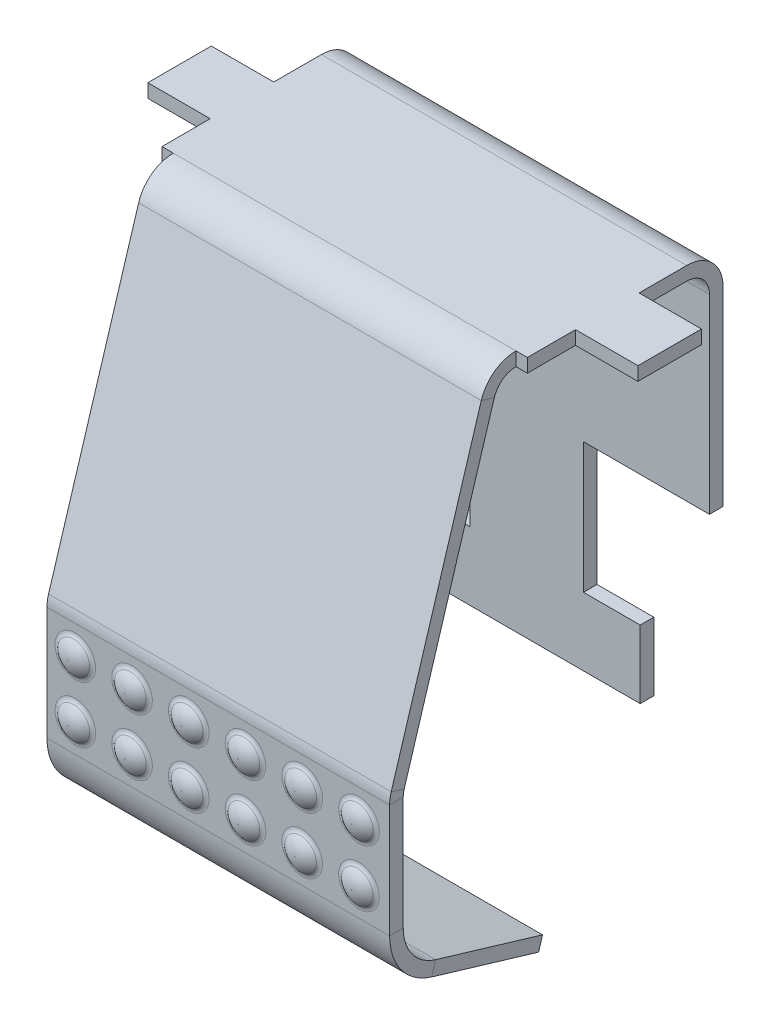
from build123d import *

# Parameters (mm, degrees)
BASE_FLANGE1_DEPTH     = 7.9248
SKETCH6_W              = 1.4224
SKETCH6_H              = 0.3048
BOSS_EXTRUDE1_DEPTH    = 1.016
SKETCH7_W              = 2.1844
SKETCH7_H              = 9.355592462
CUT_EXTRUDE1_DEPTH     = 18.125283198
BOSS_EXTRUDE2_DEPTH    = 0.3048
CUT_EXTRUDE3_REACH     = 14.95
BOSS_EXTRUDE5_START    = 0.127
SKETCH17_W             = 1.079336494
SKETCH17_H             = 0.3048
BOSS_EXTRUDE5_DEPTH    = 0.127
SKETCH18_W             = 1.4224
SKETCH18_H             = 0.3048
BOSS_EXTRUDE6_DEPTH    = 0.508
EDGE_FLANGE1_DEPTH     = 8.1788
EDGE_FLANGE2_DEPTH     = 8.1788
EDGE_FLANGE3_DEPTH     = 8.1788
SKETCH38_R             = 0.3937
BOSS_EXTRUDE7_DEPTH    = 0.166878
FILLET1_R              = 0.530606
FILLET2_R              = 0.1524
LPATTERN3_COUNT        = 6
LPATTERN3_PITCH        = 1.27
LPATTERN3_COUNT_DIR2   = 2
LPATTERN3_PITCH_DIR2   = 1.27
FILLET1_OF_LPATTERN3_R = 0.530606
FILLET2_OF_LPATTERN3_R = 0.1524
CUT_EXTRUDE4_START     = -0.254
CUT_EXTRUDE4_DEPTH     = 0.254


# Read off the part's stored shape, not the designer's step: SurfaceCut1
# Sheet-metal steps are written as plain solids
with BuildPart() as part:
    # Sketch1 → Base-Flange1 (new body)
    with BuildSketch(Plane(origin=(0, 0, 0), x_dir=(0, 0, -1), z_dir=(1, 0, 0))):
        with BuildLine():
            Line((0, 0), (0, 4.2672))
            ThreePointArc((0, 4.2672), (-0.238063608, 4.841936392), (-0.8128, 5.08))
            Line((-0.8128, 5.08), (-4.381336494, 5.08))
            ThreePointArc((-4.381336494, 5.08), (-4.911163821, 4.88358206), (-5.184919317, 4.38925936))
            Line((-5.184919317, 4.38925936), (-6.693208159, -5.5406223))
            ThreePointArc((-6.693208159, -5.5406223), (-6.678749154, -5.857431349), (-6.544153202, -6.144591522))
            Line((-6.544153202, -6.144591522), (-5.621689854, -7.397477204))
            Line((-5.621689854, -7.397477204), (-5.253554372, -7.897477204))
            Line((-5.253554372, -7.897477204), (-5.008106423, -7.716761006))
            Line((-5.008106423, -7.716761006), (-5.376241904, -7.216761006))
            Line((-5.376241904, -7.216761006), (-6.298705252, -5.963875324))
            ThreePointArc((-6.298705252, -5.963875324), (-6.382827723, -5.784400216), (-6.391864601, -5.586394561))
            Line((-6.391864601, -5.586394561), (-4.883575758, 4.3434871))
            ThreePointArc((-4.883575758, 4.3434871), (-4.712478573, 4.652438788), (-4.381336494, 4.7752))
            Line((-4.381336494, 4.7752), (-0.8128, 4.7752))
            ThreePointArc((-0.8128, 4.7752), (-0.453589755, 4.626410245), (-0.3048, 4.2672))
            Line((-0.3048, 4.2672), (-0.3048, 0))
            Line((-0.3048, 0), (0, 0))
        make_face()
    extrude(amount=BASE_FLANGE1_DEPTH)

    # Sketch6 → Boss-Extrude1 (add)
    with BuildSketch(Plane(origin=(7.9248, 0, 0), x_dir=(0, 0, -1), z_dir=(1, 0, 0))):
        with Locations((-2.5908, 4.9276)):
            Rectangle(SKETCH6_W, SKETCH6_H)
    boss_extrude1 = extrude(amount=BOSS_EXTRUDE1_DEPTH)

    # Mirror1: Boss-Extrude1 across plane
    add(boss_extrude1.mirror(Plane(origin=(3.9624, 0, 0), x_dir=(0, 0, 1), z_dir=(1, 0, 0))))

    # Sketch7 → Cut-Extrude1 (cut, through all)
    with BuildSketch(Plane(origin=(0, 5.08, 0), x_dir=(1, 0, 0), z_dir=(0, 1, 0))):
        with Locations((0.0762, -9.059132725)):
            Rectangle(SKETCH7_W, SKETCH7_H)
        with Locations((7.8486, -9.059132725)):
            Rectangle(SKETCH7_W, SKETCH7_H)
    extrude(amount=-CUT_EXTRUDE1_DEPTH, mode=Mode.SUBTRACT)

    # Sketch8 → Boss-Extrude2 (add)
    with BuildSketch(Plane(origin=(0, 0, 0), x_dir=(-1, 0, 0), z_dir=(0, 0, -1))):
        Polygon((-5.2324, 0), (-2.6924, 0), (-2.6924, -2.921), (-1.4224, -2.921), (-1.4224, -4.445), (-6.5024, -4.445), (-6.5024, -2.921), (-5.2324, -2.921), align=None)
    extrude(amount=-BOSS_EXTRUDE2_DEPTH)

    # Sketch12 → Cut-Extrude3 (cut, up to next)
    with BuildSketch(Plane(origin=(6.7564, 0, 0), x_dir=(0, 0, -1), z_dir=(1, 0, 0)), mode=Mode.PRIVATE) as cut_extrude3_sk1:
        with BuildLine():
            Line((-4.381336494, 4.7752), (-4.381336494, 5.08))
            ThreePointArc((-4.381336494, 5.08), (-4.911163821, 4.88358206), (-5.184919317, 4.38925936))
            Line((-5.184919317, 4.38925936), (-6.693208159, -5.5406223))
            ThreePointArc((-6.693208159, -5.5406223), (-6.678749154, -5.857431349), (-6.544153202, -6.144591522))
            Line((-6.544153202, -6.144591522), (-5.253554372, -7.897477204))
            Line((-5.253554372, -7.897477204), (-5.008106423, -7.716761006))
            Line((-5.008106423, -7.716761006), (-6.298705252, -5.963875324))
            ThreePointArc((-6.298705252, -5.963875324), (-6.382827723, -5.784400216), (-6.391864601, -5.586394561))
            Line((-6.391864601, -5.586394561), (-4.883575758, 4.3434871))
            ThreePointArc((-4.883575758, 4.3434871), (-4.712478573, 4.652438788), (-4.381336494, 4.7752))
        make_face()
    cut_extrude3_tool1 = extrude(cut_extrude3_sk1.sketch, amount=-CUT_EXTRUDE3_REACH, mode=Mode.PRIVATE) & part.part
    add(cut_extrude3_tool1.solids().sort_by_distance((6.7564, 4.9276, 4.513171))[0], mode=Mode.SUBTRACT)

    # Sketch17 → Boss-Extrude5 (add)
    with BuildSketch(Plane.ZY.offset(BOSS_EXTRUDE5_START)):
        with BuildLine():
            Line((0.3048, 0), (0.3048, 4.2672))
            ThreePointArc((0.3048, 4.2672), (0.453589755, 4.626410245), (0.8128, 4.7752))
            Line((0.8128, 4.7752), (1.8796, 4.7752))
            Line((1.8796, 4.7752), (1.8796, 5.08))
            Line((1.8796, 5.08), (0.8128, 5.08))
            ThreePointArc((0.8128, 5.08), (0.238063608, 4.841936392), (0, 4.2672))
            Line((0, 4.2672), (0, 0))
            Line((0, 0), (0.3048, 0))
        make_face()
        with Locations((3.841668247, 4.9276)):
            Rectangle(SKETCH17_W, SKETCH17_H)
    boss_extrude5 = extrude(amount=-BOSS_EXTRUDE5_DEPTH)

    # Sketch18 → Boss-Extrude6 (add)
    with BuildSketch(Plane.ZY.offset(1.016)):
        with Locations((2.5908, 4.9276)):
            Rectangle(SKETCH18_W, SKETCH18_H)
    boss_extrude6 = extrude(amount=BOSS_EXTRUDE6_DEPTH)

    # Mirror2: Boss-Extrude5, Boss-Extrude6 across plane
    add(boss_extrude5.mirror(Plane(origin=(3.9624, 0, 0), x_dir=(0, 0, 1), z_dir=(1, 0, 0))))
    add(boss_extrude6.mirror(Plane(origin=(3.9624, 0, 0), x_dir=(0, 0, 1), z_dir=(1, 0, 0))))

    # Edge-Flange1 section (across the edge) → Edge-Flange1 (add)
    with BuildSketch(Plane(origin=(8.0518, 4.7752, 4.756922219), x_dir=(0, -0.29313697988126164, -0.9560704529615445), z_dir=(-1, 0, 0))):
        with BuildLine():
            Line((-0.3048, 0.375585725), (-0.3048, 7.254186565))
            Line((-0.3048, 7.254186565), (0, 7.254186565))
            Line((0, 7.254186565), (0, 0.375585725))
            ThreePointArc((0, 0.375585725), (0.099519828, 0.073579187), (0.359086414, -0.110098065))
            Line((0.359086414, -0.110098065), (0.269738263, -0.401508339))
            ThreePointArc((0.269738263, -0.401508339), (-0.145568275, -0.107624736), (-0.3048, 0.375585725))
        make_face()
    extrude(amount=EDGE_FLANGE1_DEPTH)

    # Edge-Flange2 section (across the edge) → Edge-Flange2 (add)
    with BuildSketch(Plane(origin=(8.0518, -2.233098073, 6.90570877), x_dir=(0, 0, -1), z_dir=(-1, 0, 0))):
        with BuildLine():
            Line((-0.3048, 0.076128948), (-0.3048, 2.616242631))
            Line((-0.3048, 2.616242631), (0, 2.616242631))
            Line((0, 2.616242631), (0, 0.076128948))
            ThreePointArc((0, 0.076128948), (0.005610029, 0.00084072), (0.02231621, -0.072784638))
            Line((0.02231621, -0.072784638), (-0.269094064, -0.162132789))
            ThreePointArc((-0.269094064, -0.162132789), (-0.295823953, -0.044332217), (-0.3048, 0.076128948))
        make_face()
    extrude(amount=EDGE_FLANGE2_DEPTH)

    # Edge-Flange3 section (across the edge) → Edge-Flange3 (add)
    with BuildSketch(Plane(origin=(8.0518, -5.606107734, 6.90570877), x_dir=(0, 0.9581285182650292, -0.2863385103112391), z_dir=(-1, 0, 0))):
        with BuildLine():
            Line((-0.3048, 0.75676703), (-0.3048, 3.255115835))
            Line((-0.3048, 3.255115835), (0, 3.255115835))
            Line((0, 3.255115835), (0, 0.75676703))
            ThreePointArc((0, 0.75676703), (0.201190008, 0.149856265), (0.725080074, -0.216691544))
            Line((0.725080074, -0.216691544), (0.637804096, -0.508729117))
            ThreePointArc((0.637804096, -0.508729117), (-0.043252989, -0.032216965), (-0.3048, 0.75676703))
        make_face()
    extrude(amount=EDGE_FLANGE3_DEPTH)

    # Sketch38 → Boss-Extrude7 (add)
    with BuildSketch(Plane.XY.offset(7.21050877)):
        with Locations(Location((0.762, -2.944255442, 0), (0, 0, 90))):
            Circle(SKETCH38_R)
    boss_extrude7 = extrude(amount=BOSS_EXTRUDE7_DEPTH)

    # Fillet1
    # the kernel refuses this fillet: 0.530606 mm, written as the material it takes off along each edge
    with BuildSketch(Plane(origin=(0.762, -2.944255442, 7.37738677), x_dir=(0, 1, 0), z_dir=(1, 0, 0))) as fillet1_piece_1:
        with BuildLine():
            CenterArc((0.007378024, -0.530606), FILLET1_R, 43.274584136, 46.725415864)
            Line((0.007378024, 0), (0.007378024, 0.01061212))
            Line((0.007378024, 0.01061212), (0.3937, 0.01061212))
            Line((0.3937, 0.01061212), (0.40431212, 0))
            ThreePointArc((0.40431212, 0), (0.40431212, -0.083439), (0.40142644, -0.15960344))
            Line((0.40142644, -0.15960344), (0.3937, -0.166878))
        make_face()
    revolve(axis=Axis((0.762, -2.944255442, 7.37738677), (0, 0, 1)), mode=Mode.SUBTRACT)

    # Fillet2
    fillet2_edges = [part.edges().sort_by_distance(p)[0] for p in [
        (0.762, -3.337955442, 7.21050877),
    ]]
    fillet(fillet2_edges, radius=FILLET2_R)

    # SurfaceCut1 outline → SurfaceCut1 (revolve, cut)
    with BuildSketch(Plane(origin=(0.762, -2.944255442, 0), x_dir=(1, 0, 0), z_dir=(0, -1, 0))):
        with BuildLine():
            Line((0, 6.90570877), (0.454713562, 6.90570877))
            ThreePointArc((0.454713562, 6.90570877), (0.294912925, 6.934544911), (0.155269914, 7.017415873))
            ThreePointArc((0.155269914, 7.017415873), (0.086301783, 7.058344921), (0.007378024, 7.07258677))
            Line((0.007378024, 7.07258677), (0, 7.07258677))
            Line((0, 7.07258677), (0, 6.90570877))
        make_face()
    surfacecut1 = revolve(axis=Axis((0.762, -2.944255442, 0), (0, 0, 1)), mode=Mode.SUBTRACT)

    # LPattern3: Boss-Extrude7, SurfaceCut1 6 × 2
    with Locations(*[(i * LPATTERN3_PITCH, -j * LPATTERN3_PITCH_DIR2, 0) for i in range(LPATTERN3_COUNT) for j in range(LPATTERN3_COUNT_DIR2) if (i, j) != (0, 0)]):
        add(boss_extrude7)
        add(surfacecut1, mode=Mode.SUBTRACT)

    # Fillet1 of LPattern3
    # the kernel refuses this fillet: 0.530606 mm, written as the material it takes off along each edge
    with BuildSketch(Plane(origin=(0.762, -4.214255442, 7.37738677), x_dir=(0, 1, 0), z_dir=(1, 0, 0))) as fillet1_of_lpattern3_piece_1:
        with BuildLine():
            CenterArc((0.007378024, -0.530606), FILLET1_OF_LPATTERN3_R, 43.274584136, 46.725415864)
            Line((0.007378024, 0), (0.007378024, 0.01061212))
            Line((0.007378024, 0.01061212), (0.3937, 0.01061212))
            Line((0.3937, 0.01061212), (0.40431212, 0))
            ThreePointArc((0.40431212, 0), (0.40431212, -0.083439), (0.40142644, -0.15960344))
            Line((0.40142644, -0.15960344), (0.3937, -0.166878))
        make_face()
    revolve(axis=Axis((0.762, -4.214255442, 7.37738677), (0, 0, 1)), mode=Mode.SUBTRACT)
    with BuildSketch(Plane(origin=(2.032, -2.944255442, 7.37738677), x_dir=(0, 1, 0), z_dir=(1, 0, 0))) as fillet1_of_lpattern3_piece_2:
        with BuildLine():
            CenterArc((0.007378024, -0.530606), FILLET1_OF_LPATTERN3_R, 43.274584136, 46.725415864)
            Line((0.007378024, 0), (0.007378024, 0.01061212))
            Line((0.007378024, 0.01061212), (0.3937, 0.01061212))
            Line((0.3937, 0.01061212), (0.40431212, 0))
            ThreePointArc((0.40431212, 0), (0.40431212, -0.083439), (0.40142644, -0.15960344))
            Line((0.40142644, -0.15960344), (0.3937, -0.166878))
        make_face()
    revolve(axis=Axis((2.032, -2.944255442, 7.37738677), (0, 0, 1)), mode=Mode.SUBTRACT)
    with BuildSketch(Plane(origin=(2.032, -4.214255442, 7.37738677), x_dir=(0, 1, 0), z_dir=(1, 0, 0))) as fillet1_of_lpattern3_piece_3:
        with BuildLine():
            CenterArc((0.007378024, -0.530606), FILLET1_OF_LPATTERN3_R, 43.274584136, 46.725415864)
            Line((0.007378024, 0), (0.007378024, 0.01061212))
            Line((0.007378024, 0.01061212), (0.3937, 0.01061212))
            Line((0.3937, 0.01061212), (0.40431212, 0))
            ThreePointArc((0.40431212, 0), (0.40431212, -0.083439), (0.40142644, -0.15960344))
            Line((0.40142644, -0.15960344), (0.3937, -0.166878))
        make_face()
    revolve(axis=Axis((2.032, -4.214255442, 7.37738677), (0, 0, 1)), mode=Mode.SUBTRACT)
    with BuildSketch(Plane(origin=(3.302, -2.944255442, 7.37738677), x_dir=(0, 1, 0), z_dir=(1, 0, 0))) as fillet1_of_lpattern3_piece_4:
        with BuildLine():
            CenterArc((0.007378024, -0.530606), FILLET1_OF_LPATTERN3_R, 43.274584136, 46.725415864)
            Line((0.007378024, 0), (0.007378024, 0.01061212))
            Line((0.007378024, 0.01061212), (0.3937, 0.01061212))
            Line((0.3937, 0.01061212), (0.40431212, 0))
            ThreePointArc((0.40431212, 0), (0.40431212, -0.083439), (0.40142644, -0.15960344))
            Line((0.40142644, -0.15960344), (0.3937, -0.166878))
        make_face()
    revolve(axis=Axis((3.302, -2.944255442, 7.37738677), (0, 0, 1)), mode=Mode.SUBTRACT)
    with BuildSketch(Plane(origin=(3.302, -4.214255442, 7.37738677), x_dir=(0, 1, 0), z_dir=(1, 0, 0))) as fillet1_of_lpattern3_piece_5:
        with BuildLine():
            CenterArc((0.007378024, -0.530606), FILLET1_OF_LPATTERN3_R, 43.274584136, 46.725415864)
            Line((0.007378024, 0), (0.007378024, 0.01061212))
            Line((0.007378024, 0.01061212), (0.3937, 0.01061212))
            Line((0.3937, 0.01061212), (0.40431212, 0))
            ThreePointArc((0.40431212, 0), (0.40431212, -0.083439), (0.40142644, -0.15960344))
            Line((0.40142644, -0.15960344), (0.3937, -0.166878))
        make_face()
    revolve(axis=Axis((3.302, -4.214255442, 7.37738677), (0, 0, 1)), mode=Mode.SUBTRACT)
    with BuildSketch(Plane(origin=(4.572, -2.944255442, 7.37738677), x_dir=(0, 1, 0), z_dir=(1, 0, 0))) as fillet1_of_lpattern3_piece_6:
        with BuildLine():
            CenterArc((0.007378024, -0.530606), FILLET1_OF_LPATTERN3_R, 43.274584136, 46.725415864)
            Line((0.007378024, 0), (0.007378024, 0.01061212))
            Line((0.007378024, 0.01061212), (0.3937, 0.01061212))
            Line((0.3937, 0.01061212), (0.40431212, 0))
            ThreePointArc((0.40431212, 0), (0.40431212, -0.083439), (0.40142644, -0.15960344))
            Line((0.40142644, -0.15960344), (0.3937, -0.166878))
        make_face()
    revolve(axis=Axis((4.572, -2.944255442, 7.37738677), (0, 0, 1)), mode=Mode.SUBTRACT)
    with BuildSketch(Plane(origin=(4.572, -4.214255442, 7.37738677), x_dir=(0, 1, 0), z_dir=(1, 0, 0))) as fillet1_of_lpattern3_piece_7:
        with BuildLine():
            CenterArc((0.007378024, -0.530606), FILLET1_OF_LPATTERN3_R, 43.274584136, 46.725415864)
            Line((0.007378024, 0), (0.007378024, 0.01061212))
            Line((0.007378024, 0.01061212), (0.3937, 0.01061212))
            Line((0.3937, 0.01061212), (0.40431212, 0))
            ThreePointArc((0.40431212, 0), (0.40431212, -0.083439), (0.40142644, -0.15960344))
            Line((0.40142644, -0.15960344), (0.3937, -0.166878))
        make_face()
    revolve(axis=Axis((4.572, -4.214255442, 7.37738677), (0, 0, 1)), mode=Mode.SUBTRACT)
    with BuildSketch(Plane(origin=(5.842, -2.944255442, 7.37738677), x_dir=(0, 1, 0), z_dir=(1, 0, 0))) as fillet1_of_lpattern3_piece_8:
        with BuildLine():
            CenterArc((0.007378024, -0.530606), FILLET1_OF_LPATTERN3_R, 43.274584136, 46.725415864)
            Line((0.007378024, 0), (0.007378024, 0.01061212))
            Line((0.007378024, 0.01061212), (0.3937, 0.01061212))
            Line((0.3937, 0.01061212), (0.40431212, 0))
            ThreePointArc((0.40431212, 0), (0.40431212, -0.083439), (0.40142644, -0.15960344))
            Line((0.40142644, -0.15960344), (0.3937, -0.166878))
        make_face()
    revolve(axis=Axis((5.842, -2.944255442, 7.37738677), (0, 0, 1)), mode=Mode.SUBTRACT)
    with BuildSketch(Plane(origin=(5.842, -4.214255442, 7.37738677), x_dir=(0, 1, 0), z_dir=(1, 0, 0))) as fillet1_of_lpattern3_piece_9:
        with BuildLine():
            CenterArc((0.007378024, -0.530606), FILLET1_OF_LPATTERN3_R, 43.274584136, 46.725415864)
            Line((0.007378024, 0), (0.007378024, 0.01061212))
            Line((0.007378024, 0.01061212), (0.3937, 0.01061212))
            Line((0.3937, 0.01061212), (0.40431212, 0))
            ThreePointArc((0.40431212, 0), (0.40431212, -0.083439), (0.40142644, -0.15960344))
            Line((0.40142644, -0.15960344), (0.3937, -0.166878))
        make_face()
    revolve(axis=Axis((5.842, -4.214255442, 7.37738677), (0, 0, 1)), mode=Mode.SUBTRACT)
    with BuildSketch(Plane(origin=(7.112, -2.944255442, 7.37738677), x_dir=(0, 1, 0), z_dir=(1, 0, 0))) as fillet1_of_lpattern3_piece_10:
        with BuildLine():
            CenterArc((0.007378024, -0.530606), FILLET1_OF_LPATTERN3_R, 43.274584136, 46.725415864)
            Line((0.007378024, 0), (0.007378024, 0.01061212))
            Line((0.007378024, 0.01061212), (0.3937, 0.01061212))
            Line((0.3937, 0.01061212), (0.40431212, 0))
            ThreePointArc((0.40431212, 0), (0.40431212, -0.083439), (0.40142644, -0.15960344))
            Line((0.40142644, -0.15960344), (0.3937, -0.166878))
        make_face()
    revolve(axis=Axis((7.112, -2.944255442, 7.37738677), (0, 0, 1)), mode=Mode.SUBTRACT)
    with BuildSketch(Plane(origin=(7.112, -4.214255442, 7.37738677), x_dir=(0, 1, 0), z_dir=(1, 0, 0))) as fillet1_of_lpattern3_piece_11:
        with BuildLine():
            CenterArc((0.007378024, -0.530606), FILLET1_OF_LPATTERN3_R, 43.274584136, 46.725415864)
            Line((0.007378024, 0), (0.007378024, 0.01061212))
            Line((0.007378024, 0.01061212), (0.3937, 0.01061212))
            Line((0.3937, 0.01061212), (0.40431212, 0))
            ThreePointArc((0.40431212, 0), (0.40431212, -0.083439), (0.40142644, -0.15960344))
            Line((0.40142644, -0.15960344), (0.3937, -0.166878))
        make_face()
    revolve(axis=Axis((7.112, -4.214255442, 7.37738677), (0, 0, 1)), mode=Mode.SUBTRACT)

    # Fillet2 of LPattern3
    fillet2_of_lpattern3_edges = [part.edges().sort_by_distance(p)[0] for p in [
        (0.762, -4.607955442, 7.21050877),
        (2.032, -3.337955442, 7.21050877),
        (2.032, -4.607955442, 7.21050877),
        (3.302, -3.337955442, 7.21050877),
        (3.302, -4.607955442, 7.21050877),
        (4.572, -3.337955442, 7.21050877),
        (4.572, -4.607955442, 7.21050877),
        (5.842, -3.337955442, 7.21050877),
        (5.842, -4.607955442, 7.21050877),
        (7.112, -3.337955442, 7.21050877),
        (7.112, -4.607955442, 7.21050877),
    ]]
    fillet(fillet2_of_lpattern3_edges, radius=FILLET2_OF_LPATTERN3_R)

    # Sketch44 → Cut-Extrude4 (cut)
    with BuildSketch(Plane.ZY.offset(0.127).offset(CUT_EXTRUDE4_START)):
        with BuildLine():
            Line((4.381336494, 5.08), (4.381336494, 4.7752))
            ThreePointArc((4.381336494, 4.7752), (4.683343033, 4.675680172), (4.867020284, 4.416113586))
            Line((4.867020284, 4.416113586), (6.883392561, -2.160313435))
            ThreePointArc((6.883392561, -2.160313435), (6.900098741, -2.233938793), (6.90570877, -2.309227021))
            Line((6.90570877, -2.309227021), (6.90570877, -4.849340704))
            ThreePointArc((6.90570877, -4.849340704), (6.704518762, -5.45625147), (6.180628697, -5.822799279))
            Line((6.180628697, -5.822799279), (3.786889459, -6.538172754))
            Line((3.786889459, -6.538172754), (3.874165437, -6.830210326))
            Line((3.874165437, -6.830210326), (6.267904675, -6.114836851))
            ThreePointArc((6.267904675, -6.114836851), (6.94896176, -5.638324699), (7.21050877, -4.849340704))
            Line((7.21050877, -4.849340704), (7.21050877, -2.309227021))
            ThreePointArc((7.21050877, -2.309227021), (7.201532724, -2.188765856), (7.174802835, -2.070965284))
            Line((7.174802835, -2.070965284), (5.158430559, 4.505461737))
            ThreePointArc((5.158430559, 4.505461737), (4.864546956, 4.920768275), (4.381336494, 5.08))
        make_face()
    cut_extrude4 = extrude(amount=CUT_EXTRUDE4_DEPTH, mode=Mode.SUBTRACT)

    # Mirror3: Cut-Extrude4 across plane
    add(cut_extrude4.mirror(Plane(origin=(3.9624, 0, 0), x_dir=(0, 0, 1), z_dir=(1, 0, 0))), mode=Mode.SUBTRACT)


solid = part.part
